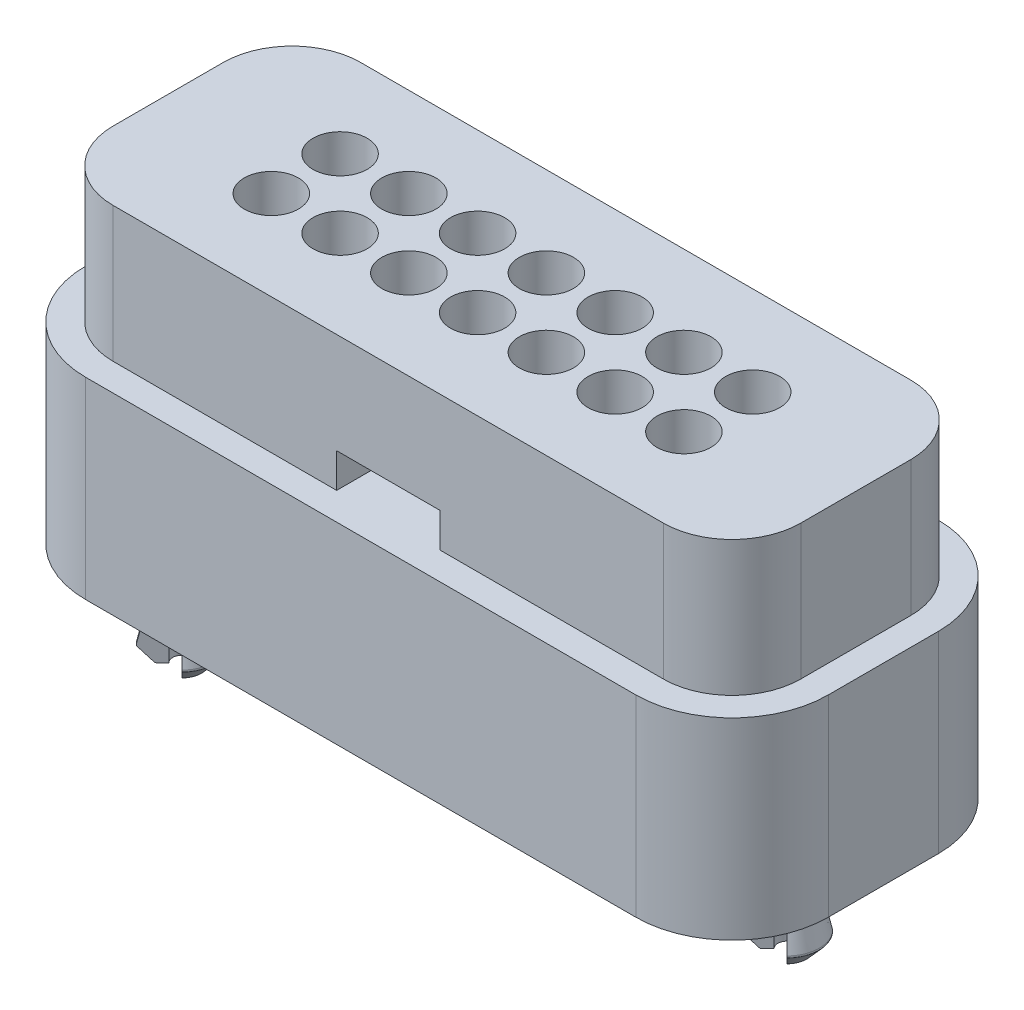
from build123d import *

# Parameters (mm, degrees)
SKETCH1_R           = 0.5
BOSS_EXTRUDE1_DEPTH = 6.050026
BOSS_EXTRUDE2_DEPTH = 3.556
SKETCH4_W           = 1.905
SKETCH4_H           = 0.635
CUT_EXTRUDE1_DEPTH  = 0.635
SKETCH5_W           = 1.905
SKETCH5_H           = 0.635
CUT_EXTRUDE2_DEPTH  = 0.635
FILLET1_R           = 0.635
REVOLVE1_ANGLE      = 90
REVOLVE2_ANGLE      = 90
REVOLVE3_ANGLE      = 90
FILLET2_R           = 0.35
FILLET3_R           = 0.05


with BuildPart() as part:
    # Sketch1 → Boss-Extrude1 (new body)
    with BuildSketch(Plane(origin=(0, 0, 0), x_dir=(1, 0, 0), z_dir=(0, 1, 0))):
        with BuildLine():
            Line((-1.27, -1.651), (8.89, -1.651))
            ThreePointArc((8.89, -1.651), (9.788025612, -1.279025612), (10.16, -0.381))
            Line((10.16, -0.381), (10.16, 1.651))
            ThreePointArc((10.16, 1.651), (9.788025612, 2.549025612), (8.89, 2.921))
            Line((8.89, 2.921), (-1.27, 2.921))
            ThreePointArc((-1.27, 2.921), (-2.168025612, 2.549025612), (-2.54, 1.651))
            Line((-2.54, 1.651), (-2.54, -0.381))
            ThreePointArc((-2.54, -0.381), (-2.168025612, -1.279025612), (-1.27, -1.651))
        make_face()
        with Locations(Location((0, 0, 0), (0, 0, 270))):
            Circle(SKETCH1_R, mode=Mode.SUBTRACT)
        with Locations(Location((1.27, 0, 0), (0, 0, 270))):
            Circle(SKETCH1_R, mode=Mode.SUBTRACT)
        with Locations(Location((2.54, 0, 0), (0, 0, 270))):
            Circle(SKETCH1_R, mode=Mode.SUBTRACT)
        with Locations(Location((3.81, 0, 0), (0, 0, 270))):
            Circle(SKETCH1_R, mode=Mode.SUBTRACT)
        with Locations(Location((5.08, 0, 0), (0, 0, 270))):
            Circle(SKETCH1_R, mode=Mode.SUBTRACT)
        with Locations(Location((6.35, 0, 0), (0, 0, 270))):
            Circle(SKETCH1_R, mode=Mode.SUBTRACT)
        with Locations(Location((1.27, 1.27, 0), (0, 0, 270))):
            Circle(SKETCH1_R, mode=Mode.SUBTRACT)
        with Locations(Location((2.54, 1.27, 0), (0, 0, 270))):
            Circle(SKETCH1_R, mode=Mode.SUBTRACT)
        with Locations(Location((3.81, 1.27, 0), (0, 0, 270))):
            Circle(SKETCH1_R, mode=Mode.SUBTRACT)
        with Locations(Location((5.08, 1.27, 0), (0, 0, 270))):
            Circle(SKETCH1_R, mode=Mode.SUBTRACT)
        with Locations(Location((6.35, 1.27, 0), (0, 0, 270))):
            Circle(SKETCH1_R, mode=Mode.SUBTRACT)
        with Locations(Location((0, 1.27, 0), (0, 0, 270))):
            Circle(SKETCH1_R, mode=Mode.SUBTRACT)
        with Locations(Location((7.62, 0, 0), (0, 0, 270))):
            Circle(SKETCH1_R, mode=Mode.SUBTRACT)
        with Locations(Location((7.62, 1.27, 0), (0, 0, 270))):
            Circle(SKETCH1_R, mode=Mode.SUBTRACT)
    extrude(amount=BOSS_EXTRUDE1_DEPTH)

    # Sketch1<3> → Boss-Extrude2 (add)
    with BuildSketch(Plane(origin=(0, 0, 0), x_dir=(1, 0, 0), z_dir=(0, 1, 0))):
        with BuildLine():
            ThreePointArc((-3.048, 1.651), (-2.527235857, 2.908235857), (-1.27, 3.429))
            Line((-1.27, 3.429), (8.89, 3.429))
            ThreePointArc((8.89, 3.429), (10.147235857, 2.908235857), (10.668, 1.651))
            Line((10.668, 1.651), (10.668, -0.381))
            ThreePointArc((10.668, -0.381), (10.147235857, -1.638235857), (8.89, -2.159))
            Line((8.89, -2.159), (-1.27, -2.159))
            ThreePointArc((-1.27, -2.159), (-2.527235857, -1.638235857), (-3.048, -0.381))
            Line((-3.048, -0.381), (-3.048, 1.651))
        make_face()
        with BuildLine():
            Line((-2.54, -0.381), (-2.54, 1.651))
            ThreePointArc((-2.54, 1.651), (-2.168025612, 2.549025612), (-1.27, 2.921))
            Line((-1.27, 2.921), (8.89, 2.921))
            ThreePointArc((8.89, 2.921), (9.788025612, 2.549025612), (10.16, 1.651))
            Line((10.16, 1.651), (10.16, -0.381))
            ThreePointArc((10.16, -0.381), (9.788025612, -1.279025612), (8.89, -1.651))
            Line((8.89, -1.651), (-1.27, -1.651))
            ThreePointArc((-1.27, -1.651), (-2.168025612, -1.279025612), (-2.54, -0.381))
        make_face(mode=Mode.SUBTRACT)
    extrude(amount=BOSS_EXTRUDE2_DEPTH)

    # Sketch4 → Cut-Extrude1 (cut)
    with BuildSketch(Plane.XY.offset(1.651)):
        with Locations((3.81, 3.8735)):
            Rectangle(SKETCH4_W, SKETCH4_H)
    extrude(amount=-CUT_EXTRUDE1_DEPTH, mode=Mode.SUBTRACT)

    # Sketch5 → Cut-Extrude2 (cut)
    with BuildSketch(Plane.XY.offset(-2.921)):
        with Locations((3.81, 3.8735)):
            Rectangle(SKETCH5_W, SKETCH5_H)
    extrude(amount=CUT_EXTRUDE2_DEPTH, mode=Mode.SUBTRACT)

    # Fillet1
    fillet1_edges = [part.edges().sort_by_distance(p)[0] for p in [
        (3.81, 4.191, 1.016),
        (3.81, 4.191, -2.286),
    ]]
    fillet(fillet1_edges, radius=FILLET1_R - 0.0001)  # a hair under: the kernel refuses the full size

    # Sketch6 → Revolve1 (revolve, symmetric)
    with BuildSketch(Plane.XY.offset(0.381)) as revolve1_sk:
        Polygon((-1.1, 0), (-0.67, 0), (-0.82, -0.96), (-0.67, -1.620506778), (-0.92, -1.9), (-1.1, -1.9), align=None)
        Polygon((-1.87, 0), (-1.44, 0), (-1.44, -1.9), (-1.62, -1.9), (-1.87, -1.620506778), (-1.72, -0.96), align=None)
    revolve(axis=Axis((-1.27, 0, 0.381), (0, -1, 0)), revolution_arc=REVOLVE1_ANGLE / 2)
    revolve(revolve1_sk.sketch, axis=Axis((-1.27, 0, 0.381), (0, 1, 0)), revolution_arc=REVOLVE1_ANGLE / 2)

    # Sketch8 → Revolve2 (revolve, symmetric)
    with BuildSketch(Plane.XY.offset(-0.635)) as revolve2_sk:
        Polygon((8.29, 0), (8.72, 0), (8.72, -1.9), (8.54, -1.9), (8.29, -1.620506778), (8.44, -0.96), align=None)
        Polygon((9.06, 0), (9.49, 0), (9.34, -0.96), (9.49, -1.620506778), (9.24, -1.9), (9.06, -1.9), align=None)
    revolve(axis=Axis((8.89, 0, -0.635), (0, -1, 0)), revolution_arc=REVOLVE2_ANGLE / 2)
    revolve(revolve2_sk.sketch, axis=Axis((8.89, 0, -0.635), (0, 1, 0)), revolution_arc=REVOLVE2_ANGLE / 2)

    # Sketch7 → Revolve3 (revolve, symmetric)
    with BuildSketch(Plane.XY.offset(-1.651)) as revolve3_sk:
        Polygon((-1.1, 0), (-0.67, 0), (-0.82, -0.96), (-0.67, -1.620506778), (-0.92, -1.9), (-1.1, -1.9), align=None)
        Polygon((-1.87, 0), (-1.44, 0), (-1.44, -1.9), (-1.62, -1.9), (-1.87, -1.620506778), (-1.72, -0.96), align=None)
    revolve(axis=Axis((-1.27, 0, -1.651), (0, -1, 0)), revolution_arc=REVOLVE3_ANGLE / 2)
    revolve(revolve3_sk.sketch, axis=Axis((-1.27, 0, -1.651), (0, 1, 0)), revolution_arc=REVOLVE3_ANGLE / 2)

    # Fillet2
    fillet2_edges = [part.edges().sort_by_distance(p)[0] for p in [
        (-0.67, 0, 0.381),
        (-1.87, 0, 0.381),
        (8.29, 0, -0.635),
        (9.49, 0, -0.635),
        (-0.67, 0, -1.651),
        (-1.87, 0, -1.651),
    ]]
    fillet(fillet2_edges, radius=FILLET2_R)

    # Fillet3
    fillet3_edges = [part.edges().sort_by_distance(p)[0] for p in [
        (-0.92, -1.9, 0.381),
        (-0.67, -1.620506778, 0.381),
        (-0.82, -0.96, 0.381),
        (-1.72, -0.96, 0.381),
        (-1.87, -1.620506778, 0.381),
        (-1.62, -1.9, 0.381),
        (8.44, -0.96, -0.635),
        (8.29, -1.620506778, -0.635),
        (8.54, -1.9, -0.635),
        (9.24, -1.9, -0.635),
        (9.49, -1.620506778, -0.635),
        (9.34, -0.96, -0.635),
        (-0.92, -1.9, -1.651),
        (-0.67, -1.620506778, -1.651),
        (-0.82, -0.96, -1.651),
        (-1.72, -0.96, -1.651),
        (-1.87, -1.620506778, -1.651),
        (-1.62, -1.9, -1.651),
    ]]
    fillet(fillet3_edges, radius=FILLET3_R)


solid = part.part
